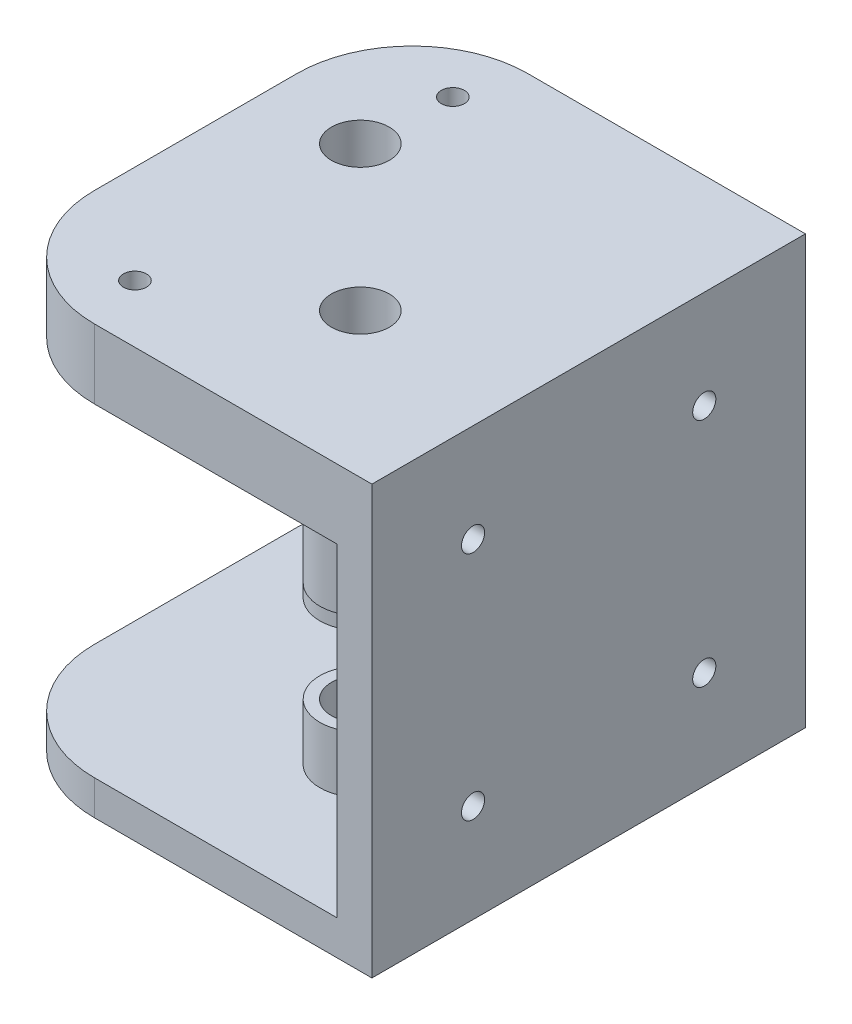
from build123d import *
from build123d.topology import SkipClean

# Parameters (mm, degrees)
TOPSKETCH1_W                                     = 34
TOPSKETCH1_H                                     = 37.5
TOPSKETCH1_R                                     = 1
TOPSKETCH1_R_2                                   = 2.5
BOSS_EXTRUDE1_DEPTH                              = 6
TOPLEFTRISERBOSS_EXTRUDE2_START                  = 4.9
TOPLEFTRISER_R                                   = 2.5
TOPLEFTRISERBOSS_EXTRUDE2_DEPTH                  = 4.9
TOPRIGHTRISERBOSS_EXTRUDE3_START                 = 14.4
TOPRIGHTRISER_R                                  = 2.5
TOPRIGHTRISERBOSS_EXTRUDE3_DEPTH                 = 14.4
MIDWALLSKETCH3_W                                 = 10.25
MIDWALLSKETCH3_H                                 = 3
MIDWALLSKETCH3_W_2                               = 4.5
MIDWALLSKETCH3_W_3                               = 3
MIDWALLSKETCH3_H_2                               = 37.5
WALLBOSS_EXTRUDE4_DEPTH                          = 28
BOTTOMSKETCH4_W                                  = 34
BOTTOMSKETCH4_H                                  = 37.5
BOTTOMBOSS_EXTRUDE5_DEPTH                        = 3
LOWERLEFTRISER_R                                 = 2.5
LOWERLEFTRISERBOSS_EXTRUDE6_DEPTH                = 14.4
LOWERRIGHTRISER_R                                = 2.5
LOWERRIGHTRISERBOSS_EXTRUDE7_DEPTH               = 4.9
FILLET1_R                                        = 10
TOPLEFTINSETCUT_EXTRUDE1_DEPTH                   = 1
TOPRIGHTINSETCUT_EXTRUDE2_DEPTH                  = 1
LOWERLEFTINSETCUT_EXTRUDE3_START                 = -1
LOWERLEFTINSETCUT_EXTRUDE3_DEPTH                 = 1
LOWERRIGHTINSETCUT_EXTRUDE4_START                = -1
LOWERRIGHTINSETCUT_EXTRUDE4_DEPTH                = 1
GBMOUNTINGHOLESSKETCH7_R                         = 1
GBMOUNTINGHOLESCUT_EXTRUDE5_DEPTH                = 3
PUSHPINHOLESKETCH1_R                             = 1
PUSHPINHOLECUT_EXTRUDE1_DEPTH                    = 63.69968102
BOTTOMLEFTMOUNTHOLEACCESSCUT_EXTRUDE2_DEPTH      = 10
BOTTOMLEFTMOUNTHOLEACCESSCUT_EXTRUDE2_DEPTH_BACK = 15
BOTTOMLEFTMOUNTHOLEACCESSSKETCH1_R               = 1
TOPLEFTMOUNTHOLEACCESSCUT_EXTRUDE3_DEPTH         = 52.964531173
TOPLEFTMOUNTHOLEACCESSCUT_EXTRUDE3_DEPTH_BACK    = 5
TOPLEFTMOUNTHOLEACCESSSKETCH2_R                  = 1


with BuildPart() as part:
    # TopSketch1 → Boss-Extrude1 (new body)
    with BuildSketch(Plane(origin=(0, 0, 0), x_dir=(1, 0, 0), z_dir=(0, 1, 0))):
        with Locations((17, 18.75)):
            Rectangle(TOPSKETCH1_W, TOPSKETCH1_H)
        with Locations(Location((8.5, 32.5, 0), (0, 0, 270))):
            Circle(TOPSKETCH1_R, mode=Mode.SUBTRACT)
        with Locations(Location((8.5, 5, 0), (0, 0, 270))):
            Circle(TOPSKETCH1_R, mode=Mode.SUBTRACT)
        with Locations(Location((20.5, 12.5, 0), (0, 0, 270))):
            Circle(TOPSKETCH1_R_2, mode=Mode.SUBTRACT)
        with Locations(Location((8, 25, 0), (0, 0, 270))):
            Circle(TOPSKETCH1_R_2, mode=Mode.SUBTRACT)
    extrude(amount=BOSS_EXTRUDE1_DEPTH)

    # TopLeftRiser → TopLeftRiserBoss-Extrude2 (add)
    with SkipClean():  # the faces are left unmerged after this step: merging them gives an invalid solid
        with BuildSketch(Plane.XZ.offset(TOPLEFTRISERBOSS_EXTRUDE2_START)):
            with BuildLine():
                Line((5.75, -27.680951324), (5.75, -37.5))
                Line((5.75, -37.5), (10.25, -37.5))
                Line((10.25, -37.5), (10.25, -27.680951324))
                ThreePointArc((10.25, -27.680951324), (8, -21.5), (5.75, -27.680951324))
            make_face()
            with Locations(Location((8, -25, 0), (0, 0, 270))):
                Circle(TOPLEFTRISER_R, mode=Mode.SUBTRACT)
        extrude(amount=-TOPLEFTRISERBOSS_EXTRUDE2_DEPTH)

    # TopRightRiser → topRightRiserBoss-Extrude3 (add)
    with SkipClean():  # the faces are left unmerged after this step: merging them gives an invalid solid
        with BuildSketch(Plane.XZ.offset(TOPRIGHTRISERBOSS_EXTRUDE3_START)):
            with BuildLine():
                Line((18.25, -15.180951324), (18.25, -37.5))
                Line((18.25, -37.5), (22.75, -37.5))
                Line((22.75, -37.5), (22.75, -15.180951324))
                ThreePointArc((22.75, -15.180951324), (20.5, -9), (18.25, -15.180951324))
            make_face()
            with Locations(Location((20.5, -12.5, 0), (0, 0, 270))):
                Circle(TOPRIGHTRISER_R, mode=Mode.SUBTRACT)
        extrude(amount=-TOPRIGHTRISERBOSS_EXTRUDE3_DEPTH)

    # MidWallSketch3 → WallBoss-Extrude4 (add)
    with SkipClean():  # the faces are left unmerged after this step: merging them gives an invalid solid
        with BuildSketch(Plane.XZ):
            with Locations((5.125, -36)):
                Rectangle(MIDWALLSKETCH3_W, MIDWALLSKETCH3_H)
            with Locations((20.5, -36)):
                Rectangle(MIDWALLSKETCH3_W_2, MIDWALLSKETCH3_H)
            with Locations((32.5, -18.75)):
                Rectangle(MIDWALLSKETCH3_W_3, MIDWALLSKETCH3_H_2)
        extrude(amount=WALLBOSS_EXTRUDE4_DEPTH)

    # BottomSketch4 → BottomBoss-Extrude5 (add)
    with SkipClean():  # the faces are left unmerged after this step: merging them gives an invalid solid
        with BuildSketch(Plane.XZ.offset(28)):
            with Locations((17, -18.75)):
                Rectangle(BOTTOMSKETCH4_W, BOTTOMSKETCH4_H)
        extrude(amount=BOTTOMBOSS_EXTRUDE5_DEPTH)

    # LowerLeftRiser → LowerLeftRiserBoss-Extrude6 (add)
    with SkipClean():  # the faces are left unmerged after this step: merging them gives an invalid solid
        with BuildSketch(Plane(origin=(0, -28, 0), x_dir=(1, 0, 0), z_dir=(0, 1, 0))):
            with BuildLine():
                Line((5.75, 27.680951324), (5.75, 34.5))
                Line((5.75, 34.5), (10.25, 34.5))
                Line((10.25, 34.5), (10.25, 27.680951324))
                ThreePointArc((10.25, 27.680951324), (8, 21.5), (5.75, 27.680951324))
            make_face()
            with Locations(Location((8, 25, 0), (0, 0, 90))):
                Circle(LOWERLEFTRISER_R, mode=Mode.SUBTRACT)
        extrude(amount=LOWERLEFTRISERBOSS_EXTRUDE6_DEPTH)

    # LowerRightRiser → LowerRightRiserBoss-Extrude7 (add)
    with SkipClean():  # the faces are left unmerged after this step: merging them gives an invalid solid
        with BuildSketch(Plane(origin=(0, -28, 0), x_dir=(1, 0, 0), z_dir=(0, 1, 0))):
            with BuildLine():
                Line((18.25, 15.180951324), (18.25, 34.5))
                Line((18.25, 34.5), (22.75, 34.5))
                Line((22.75, 34.5), (22.75, 15.180951324))
                ThreePointArc((22.75, 15.180951324), (20.5, 9), (18.25, 15.180951324))
            make_face()
            with Locations(Location((20.5, 12.5, 0), (0, 0, 90))):
                Circle(LOWERRIGHTRISER_R, mode=Mode.SUBTRACT)
        extrude(amount=LOWERRIGHTRISERBOSS_EXTRUDE7_DEPTH)

    # Fillet1
    # the kernel refuses this fillet: 10 mm, written as the material it takes off along each edge
    with BuildSketch(Plane(origin=(0, -3, 0), x_dir=(1, 0, 0), z_dir=(0, -1, 0))) as fillet1_piece_1:
        with BuildLine():
            CenterArc((FILLET1_R, -FILLET1_R), FILLET1_R, 90, 90)
            Line((0, -FILLET1_R), (0, 0))
            Line((0, 0), (FILLET1_R, 0))
        make_face()
    extrude(amount=53, mode=Mode.SUBTRACT)
    with BuildSketch(Plane(origin=(0, -25, 0), x_dir=(1, 0, 0), z_dir=(0, 1, 0))) as fillet1_piece_2:
        with BuildLine():
            CenterArc((FILLET1_R, FILLET1_R), FILLET1_R, 180, 90)
            Line((0, FILLET1_R), (0, 0))
            Line((0, 0), (FILLET1_R, 0))
        make_face()
    extrude(amount=56, mode=Mode.SUBTRACT)
    with BuildSketch(Plane(origin=(0, 0, -37.5), x_dir=(0, 0, 1), z_dir=(0, -1, 0)), Plane(origin=(0, -28, -37.5), x_dir=(0, 0, 1), z_dir=(0, -1, 0))) as fillet1_piece_3:
        with BuildLine():
            CenterArc((FILLET1_R, -FILLET1_R), FILLET1_R, 90, 90)
            Line((0, -FILLET1_R), (0, 0))
            Line((0, 0), (FILLET1_R, 0))
        make_face()
    extrude(amount=28, mode=Mode.SUBTRACT)
    with BuildSketch(Plane(origin=(0, 0, -37.5), x_dir=(0, 0, 1), z_dir=(0, 1, 0))) as fillet1_piece_4:
        with BuildLine():
            CenterArc((FILLET1_R, FILLET1_R), FILLET1_R, 180, 90)
            Line((0, FILLET1_R), (0, 0))
            Line((0, 0), (FILLET1_R, 0))
        make_face()
    extrude(amount=31, mode=Mode.SUBTRACT)

    # TopLeftInset → TopLeftInsetCut-Extrude1 (cut)
    with BuildSketch(Plane.XZ.offset(4.9)):
        with BuildLine():
            Line((5.75, -27.680951324), (5.75, -34.5))
            Line((5.75, -34.5), (10.25, -34.5))
            Line((10.25, -34.5), (10.25, -27.680951324))
            ThreePointArc((10.25, -27.680951324), (8, -28.5), (5.75, -27.680951324))
        make_face()
    extrude(amount=-TOPLEFTINSETCUT_EXTRUDE1_DEPTH, mode=Mode.SUBTRACT)

    # TopRightInset → TopRightInsetCut-Extrude2 (cut)
    with SkipClean():  # the faces are left unmerged after this step: merging them gives an invalid solid
        with BuildSketch(Plane.XZ.offset(14.4)):
            with BuildLine():
                Line((18.25, -15.180951324), (18.25, -34.5))
                Line((18.25, -34.5), (22.75, -34.5))
                Line((22.75, -34.5), (22.75, -15.180951324))
                ThreePointArc((22.75, -15.180951324), (20.5, -16), (18.25, -15.180951324))
            make_face()
        extrude(amount=-TOPRIGHTINSETCUT_EXTRUDE2_DEPTH, mode=Mode.SUBTRACT)
    add(part.part.scale(1), mode=Mode.REPLACE)  # the faces are merged on a copy

    # LowerLeftInset → LowerLeftInsetCut-Extrude3 (cut)
    with BuildSketch(Plane(origin=(0, -13.6, 0), x_dir=(1, 0, 0), z_dir=(0, 1, 0)).offset(LOWERLEFTINSETCUT_EXTRUDE3_START)):
        with BuildLine():
            Line((5.75, 27.680951324), (5.75, 34.5))
            Line((5.75, 34.5), (10.25, 34.5))
            Line((10.25, 34.5), (10.25, 27.680951324))
            ThreePointArc((10.25, 27.680951324), (8, 28.5), (5.75, 27.680951324))
        make_face()
    extrude(amount=LOWERLEFTINSETCUT_EXTRUDE3_DEPTH, mode=Mode.SUBTRACT)

    # LowerRightInset → LowerRightInsetCut-Extrude4 (cut)
    with BuildSketch(Plane(origin=(0, -23.1, 0), x_dir=(1, 0, 0), z_dir=(0, 1, 0)).offset(LOWERRIGHTINSETCUT_EXTRUDE4_START)):
        with BuildLine():
            Line((18.25, 15.180951324), (18.25, 34.5))
            Line((18.25, 34.5), (22.75, 34.5))
            Line((22.75, 34.5), (22.75, 15.180951324))
            ThreePointArc((22.75, 15.180951324), (20.5, 16), (18.25, 15.180951324))
        make_face()
    extrude(amount=LOWERRIGHTINSETCUT_EXTRUDE4_DEPTH, mode=Mode.SUBTRACT)

    # GBMountingHolesSketch7 → GBMountingHolesCut-Extrude5 (cut)
    with BuildSketch(Plane(origin=(34, 0, 0), x_dir=(0, 0, -1), z_dir=(1, 0, 0))):
        with Locations((8.75, -2.5)):
            Circle(GBMOUNTINGHOLESSKETCH7_R)
        with Locations((8.75, -22.5)):
            Circle(GBMOUNTINGHOLESSKETCH7_R)
        with Locations((28.75, -22.5)):
            Circle(GBMOUNTINGHOLESSKETCH7_R)
        with Locations((28.75, -2.5)):
            Circle(GBMOUNTINGHOLESSKETCH7_R)
    extrude(amount=-GBMOUNTINGHOLESCUT_EXTRUDE5_DEPTH, mode=Mode.SUBTRACT)

    # PushPinHoleSketch1 → PushPinHoleCut-Extrude1 (cut, through all)
    with BuildSketch(Plane.XZ.offset(31)):
        with Locations(Location((20.5, -12.5, 0), (0, 0, 270))):
            Circle(PUSHPINHOLESKETCH1_R)
        with Locations(Location((8, -25, 0), (0, 0, 270))):
            Circle(PUSHPINHOLESKETCH1_R)
    extrude(amount=-PUSHPINHOLECUT_EXTRUDE1_DEPTH, mode=Mode.SUBTRACT)

    # BottomLeftMountHoleAccessSketch1 → BottomLeftMountHoleAccessCut-Extrude2 (cut, two sides: drawn at the far end of the back side and taken through both)
    with BuildSketch(Plane.ZY.offset(-5.75).offset(-BOTTOMLEFTMOUNTHOLEACCESSCUT_EXTRUDE2_DEPTH_BACK)):
        with Locations(Location((-28.75, -22.5, 0), (0, 0, 180))):
            Circle(BOTTOMLEFTMOUNTHOLEACCESSSKETCH1_R)
    extrude(amount=BOTTOMLEFTMOUNTHOLEACCESSCUT_EXTRUDE2_DEPTH + BOTTOMLEFTMOUNTHOLEACCESSCUT_EXTRUDE2_DEPTH_BACK, mode=Mode.SUBTRACT)

    # TopLeftMountHoleAccessSketch2 → TopLeftMountHoleAccessCut-Extrude3 (cut, two sides: drawn at the far end of the back side and taken through both)
    with BuildSketch(Plane.ZY.offset(-18.25).offset(-TOPLEFTMOUNTHOLEACCESSCUT_EXTRUDE3_DEPTH_BACK)):
        with Locations(Location((-28.75, -2.5, 0), (0, 0, 180))):
            Circle(TOPLEFTMOUNTHOLEACCESSSKETCH2_R)
    extrude(amount=TOPLEFTMOUNTHOLEACCESSCUT_EXTRUDE3_DEPTH + TOPLEFTMOUNTHOLEACCESSCUT_EXTRUDE3_DEPTH_BACK, mode=Mode.SUBTRACT)


solid = part.part
